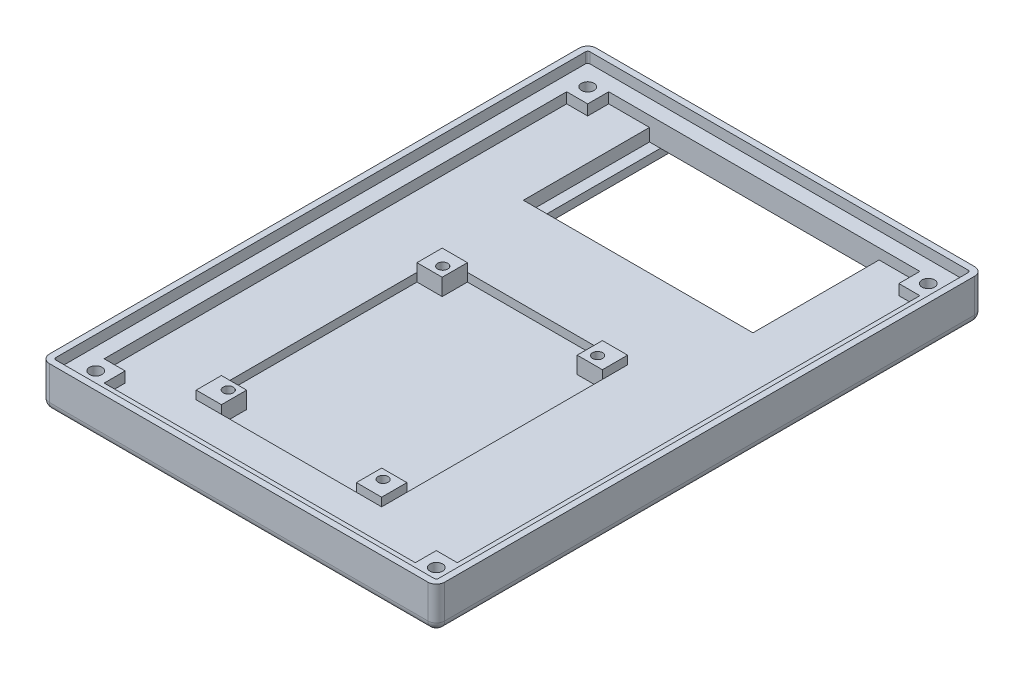
from build123d import *

# Parameters (mm, degrees)
SKETCH1_W           = 94
SKETCH1_H           = 130
BOSS_EXTRUDE1_DEPTH = 5
SKETCH2_W           = 94
SKETCH2_H           = 130
SKETCH2_W_2         = 84
SKETCH2_H_2         = 120
BOSS_EXTRUDE2_DEPTH = 5
FILLET1_R           = 2
SKETCH3_W           = 44.1
SKETCH3_H           = 58.5
CUT_EXTRUDE1_DEPTH  = 2
SKETCH5_W           = 6
SKETCH5_H           = 6
BOSS_EXTRUDE4_DEPTH = 4
SKETCH7_R           = 1.20000014
CUT_EXTRUDE2_DEPTH  = 3
SKETCH8_W           = 54.6
SKETCH8_H           = 30
CUT_EXTRUDE3_DEPTH  = 3
SKETCH9_W           = 49.4
SKETCH9_H           = 27
CUT_EXTRUDE4_DEPTH  = 2
SKETCH10_W          = 49.4
SKETCH10_H          = 6.619549161
CUT_EXTRUDE5_DEPTH  = 2
SKETCH11_W          = 5
SKETCH11_H          = 1
CUT_EXTRUDE6_DEPTH  = 3
SKETCH14_W          = 84
SKETCH14_H          = 120
CUT_EXTRUDE8_DEPTH  = 2.5
SKETCH15_W          = 5
SKETCH15_H          = 5
BOSS_EXTRUDE5_DEPTH = 2.5
SKETCH16_R          = 1.5
CUT_EXTRUDE9_DEPTH  = 161.599657534
SKETCH17_R          = 2.8
CUT_EXTRUDE10_DEPTH = 3
SKETCH18_R          = 4
CUT_EXTRUDE11_DEPTH = 2


with BuildPart() as part:
    # Sketch1 → Boss-Extrude1 (new body)
    with BuildSketch(Plane(origin=(0, 0, 0), x_dir=(1, 0, 0), z_dir=(0, 1, 0))):
        with Locations((47, 65)):
            Rectangle(SKETCH1_W, SKETCH1_H)
    extrude(amount=BOSS_EXTRUDE1_DEPTH)

    # Sketch2 → Boss-Extrude2 (add)
    with BuildSketch(Plane(origin=(0, 5, 0), x_dir=(1, 0, 0), z_dir=(0, 1, 0))):
        with Locations((47, 65)):
            Rectangle(SKETCH2_W, SKETCH2_H)
        with Locations((47, 65)):
            Rectangle(SKETCH2_W_2, SKETCH2_H_2, mode=Mode.SUBTRACT)
    extrude(amount=BOSS_EXTRUDE2_DEPTH)

    # Fillet1
    fillet1_edges = [part.edges().sort_by_distance(p)[0] for p in [
        (0, 5, -130),
        (0, 5, 0),
        (94, 5, 0),
        (47, 0, 0),
        (0, 0, -65),
        (94, 0, -65),
        (47, 0, -130),
        (94, 5, -130),
    ]]
    fillet(fillet1_edges, radius=FILLET1_R)

    # Sketch3 → Cut-Extrude1 (cut)
    with BuildSketch(Plane(origin=(0, 5, 0), x_dir=(1, 0, 0), z_dir=(0, 1, 0))):
        with Locations((43.95, 44.25)):
            Rectangle(SKETCH3_W, SKETCH3_H)
    extrude(amount=-CUT_EXTRUDE1_DEPTH, mode=Mode.SUBTRACT)

    # Sketch5 → Boss-Extrude4 (add)
    with BuildSketch(Plane(origin=(0, 3, 0), x_dir=(1, 0, 0), z_dir=(0, 1, 0))):
        with Locations((24.9, 70.5)):
            Rectangle(SKETCH5_W, SKETCH5_H)
        with Locations((63, 70.5)):
            Rectangle(SKETCH5_W, SKETCH5_H)
        with Locations((63, 18)):
            Rectangle(SKETCH5_W, SKETCH5_H)
        with Locations((24.9, 18)):
            Rectangle(SKETCH5_W, SKETCH5_H)
    extrude(amount=BOSS_EXTRUDE4_DEPTH)

    # Sketch7 → Cut-Extrude2 (cut)
    with BuildSketch(Plane(origin=(0, 7, 0), x_dir=(1, 0, 0), z_dir=(0, 1, 0))):
        with Locations((25.684600549, 69.839000092)):
            Circle(SKETCH7_R)
        with Locations((62.514600549, 69.839000092)):
            Circle(SKETCH7_R)
        with Locations((62.514600549, 18.835800092)):
            Circle(SKETCH7_R)
        with Locations((25.684600549, 18.835800092)):
            Circle(SKETCH7_R)
    extrude(amount=-CUT_EXTRUDE2_DEPTH, mode=Mode.SUBTRACT)

    # Sketch8 → Cut-Extrude3 (cut)
    with BuildSketch(Plane(origin=(0, 5, 0), x_dir=(1, 0, 0), z_dir=(0, 1, 0))):
        with Locations((47, 110)):
            Rectangle(SKETCH8_W, SKETCH8_H)
    extrude(amount=-CUT_EXTRUDE3_DEPTH, mode=Mode.SUBTRACT)

    # Sketch9 → Cut-Extrude4 (cut)
    with BuildSketch(Plane(origin=(0, 2, 0), x_dir=(1, 0, 0), z_dir=(0, 1, 0))):
        with Locations((47, 110)):
            Rectangle(SKETCH9_W, SKETCH9_H)
    extrude(amount=-CUT_EXTRUDE4_DEPTH, mode=Mode.SUBTRACT)

    # Sketch10 → Cut-Extrude5 (cut)
    with BuildSketch(Plane.XZ):
        with Locations((47, -126.809774581)):
            Rectangle(SKETCH10_W, SKETCH10_H)
    extrude(amount=-CUT_EXTRUDE5_DEPTH, mode=Mode.SUBTRACT)

    # Sketch11 → Cut-Extrude6 (cut)
    with BuildSketch(Plane(origin=(0, 0, -96.5), x_dir=(-1, 0, 0), z_dir=(0, 0, -1))):
        with Locations((-47, 1)):
            Rectangle(SKETCH11_W, SKETCH11_H)
    extrude(amount=-CUT_EXTRUDE6_DEPTH, mode=Mode.SUBTRACT)

    # Sketch14 → Cut-Extrude8 (cut)
    with BuildSketch(Plane(origin=(0, 10, 0), x_dir=(1, 0, 0), z_dir=(0, 1, 0))):
        with BuildLine():
            Line((92.5, 2), (92.5, 128))
            ThreePointArc((92.5, 128), (92.353553391, 128.353553391), (92, 128.5))
            Line((92, 128.5), (2, 128.5))
            ThreePointArc((2, 128.5), (1.646446609, 128.353553391), (1.5, 128))
            Line((1.5, 128), (1.5, 2))
            ThreePointArc((1.5, 2), (1.646446609, 1.646446609), (2, 1.5))
            Line((2, 1.5), (92, 1.5))
            ThreePointArc((92, 1.5), (92.353553391, 1.646446609), (92.5, 2))
        make_face()
        with Locations((47, 65)):
            Rectangle(SKETCH14_W, SKETCH14_H, mode=Mode.SUBTRACT)
    extrude(amount=-CUT_EXTRUDE8_DEPTH, mode=Mode.SUBTRACT)

    # Sketch15 → Boss-Extrude5 (add)
    with BuildSketch(Plane(origin=(0, 5, 0), x_dir=(1, 0, 0), z_dir=(0, 1, 0))):
        with Locations((86.5, 122.5)):
            Rectangle(SKETCH15_W, SKETCH15_H)
        with Locations((7.5, 122.5)):
            Rectangle(SKETCH15_W, SKETCH15_H)
        with Locations((7.5, 7.5)):
            Rectangle(SKETCH15_W, SKETCH15_H)
        with Locations((86.5, 7.5)):
            Rectangle(SKETCH15_W, SKETCH15_H)
    extrude(amount=BOSS_EXTRUDE5_DEPTH)

    # Sketch16 → Cut-Extrude9 (cut, through all)
    with BuildSketch(Plane(origin=(0, 7.5, 0), x_dir=(1, 0, 0), z_dir=(0, 1, 0))):
        with Locations((6.5, 123.5)):
            Circle(SKETCH16_R)
        with Locations((87.5, 123.5)):
            Circle(SKETCH16_R)
        with Locations((87.5, 6.5)):
            Circle(SKETCH16_R)
        with Locations((6.5, 6.5)):
            Circle(SKETCH16_R)
    extrude(amount=-CUT_EXTRUDE9_DEPTH, mode=Mode.SUBTRACT)

    # Sketch17 → Cut-Extrude10 (cut)
    with BuildSketch(Plane.XZ):
        with Locations((6.5, -6.5)):
            Circle(SKETCH17_R)
        with Locations((87.5, -6.5)):
            Circle(SKETCH17_R)
        with Locations((87.5, -123.5)):
            Circle(SKETCH17_R)
        with Locations((6.5, -123.5)):
            Circle(SKETCH17_R)
    extrude(amount=-CUT_EXTRUDE10_DEPTH, mode=Mode.SUBTRACT)

    # Sketch18 → Cut-Extrude11 (cut)
    with BuildSketch(Plane.XZ):
        with Locations((6.5, -123.5)):
            Circle(SKETCH18_R)
        with Locations((87.5, -123.5)):
            Circle(SKETCH18_R)
        with Locations((87.5, -6.5)):
            Circle(SKETCH18_R)
        with Locations((6.5, -6.5)):
            Circle(SKETCH18_R)
    extrude(amount=-CUT_EXTRUDE11_DEPTH, mode=Mode.SUBTRACT)


solid = part.part
